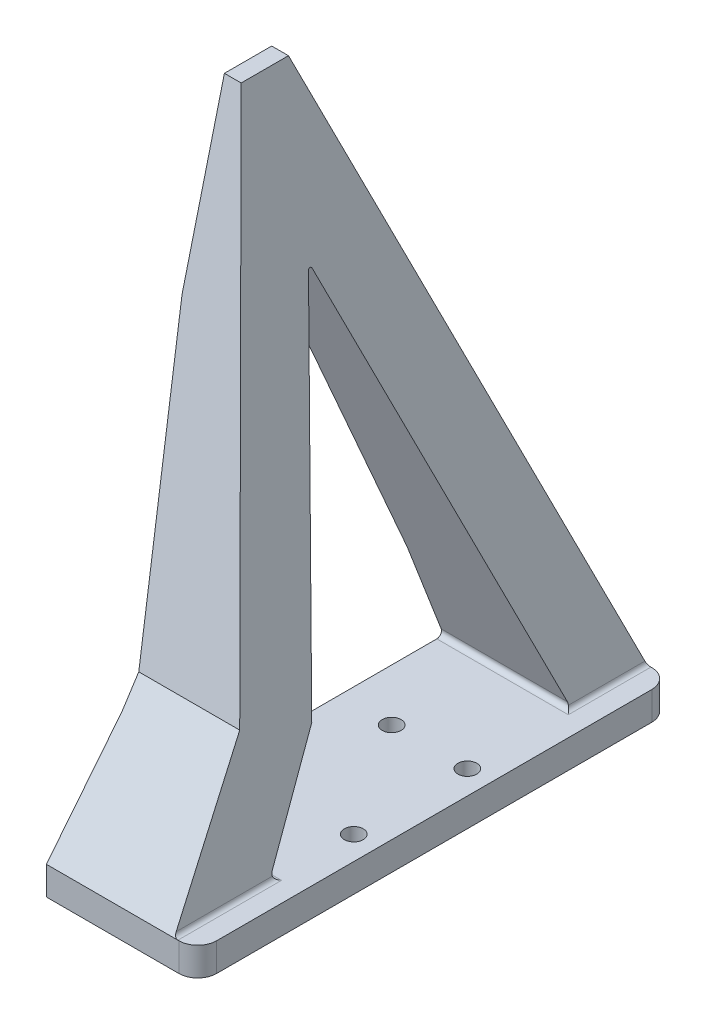
from build123d import *

# Parameters (mm, degrees)
SKETCH_1_R          = 1
EXTRUDE_1_DEPTH     = 3
SKETCH_2_W          = 16.007753667
SKETCH_2_H          = 50
EXTRUDE_2_DEPTH     = 80
CUT_EXTRUDE_1_DEPTH = 89.149011211
CUT_EXTRUDE_2_DEPTH = 81.960252593
EXTRUDE_3_DEPTH     = 3
CUT_EXTRUDE_3_DEPTH = 82.357621032
FILLET_1_R          = 0.5
FILLET_2_R          = 0.2


with BuildPart() as part:
    # 草图1 → 凸台-拉伸1 (new body)
    with BuildSketch(Plane(origin=(0, 0, 0), x_dir=(1, 0, 0), z_dir=(0, 1, 0))):
        with BuildLine():
            Line((-9.25, 25), (7.25, 25))
            ThreePointArc((7.25, 25), (8.664213562, 24.414213562), (9.25, 23))
            Line((9.25, 23), (9.25, -23))
            ThreePointArc((9.25, -23), (8.664213562, -24.414213562), (7.25, -25))
            Line((7.25, -25), (-9.25, -25))
            Line((-9.25, -25), (-9.25, 25))
        make_face()
        with Locations(Location((-1.25, 6, 0), (0, 0, 270))):
            Circle(SKETCH_1_R, mode=Mode.SUBTRACT)
        with Locations(Location((-1.25, -6, 0), (0, 0, 270))):
            Circle(SKETCH_1_R, mode=Mode.SUBTRACT)
        with Locations(Location((6.75, -6, 0), (0, 0, 270))):
            Circle(SKETCH_1_R, mode=Mode.SUBTRACT)
        with Locations(Location((6.75, 6, 0), (0, 0, 270))):
            Circle(SKETCH_1_R, mode=Mode.SUBTRACT)
    extrude(amount=EXTRUDE_1_DEPTH)

    # 草图2 → 凸台-拉伸2 (add)
    with BuildSketch(Plane(origin=(0, 3, 0), x_dir=(1, 0, 0), z_dir=(0, 1, 0))):
        with Locations((-1.246123166, 0)):
            Rectangle(SKETCH_2_W, SKETCH_2_H)
    extrude(amount=EXTRUDE_2_DEPTH)

    # 草图3 → 切除-拉伸1 (cut, through all)
    with BuildSketch(Plane(origin=(6.757753667, 0, 0), x_dir=(0, 0, -1), z_dir=(1, 0, 0))):
        Polygon((-25, 3), (-15, 15.5), (-3.181818182, 63), (1.818181818, 63), (25, 3), (32.784332669, 3), (32.784332669, 88.133626677), (-39.086773644, 88.133626677), (-39.086773644, 3), align=None)
        Polygon((-15, 3), (-8, 13), (0, 47), (17, 3), align=None)
    extrude(amount=-CUT_EXTRUDE_1_DEPTH, mode=Mode.SUBTRACT)

    # 草图4 → 切除-拉伸2 (cut, through all)
    with BuildSketch(Plane.XY.offset(25)):
        Polygon((6.757753667, 3), (6.757753667, 67.763295657), (-9.14963747, 67.763295657), align=None)
    extrude(amount=-CUT_EXTRUDE_2_DEPTH, mode=Mode.SUBTRACT)

    # 草图5 → 凸台-拉伸3 (add)
    with BuildSketch(Plane.ZY.offset(9.25)):
        Polygon((-1.818181818, 63), (-25, 3), (-25, 0), (25, 0), (25, 3), (15, 15.5), (3.181818182, 63), align=None)
        Polygon((0, 47), (-17, 3), (15, 3), (8, 13), align=None, mode=Mode.SUBTRACT)
    extrude(amount=EXTRUDE_3_DEPTH)

    # 草图6 → 切除-拉伸3 (cut, through all)
    with BuildSketch(Plane(origin=(0, 0, -25), x_dir=(-1, 0, 0), z_dir=(0, 0, -1))):
        Polygon((6.75, 0), (6.75, 13), (9.75, 45), (9.75, 64.870972757), (14.09361996, 64.870972757), (14.09361996, 0), align=None)
    extrude(amount=-CUT_EXTRUDE_3_DEPTH, mode=Mode.SUBTRACT)

    # 圆角1
    # the kernel refuses this fillet: 0.5 mm, written as the material it adds along each edge
    with BuildSketch(Plane(origin=(-6.75, 3, 15), x_dir=(0, 0, -1), z_dir=(1, 0, 0))) as fillet_1_piece_1_section:
        with BuildLine():
            CenterArc((FILLET_1_R * 1.92065556157, FILLET_1_R), FILLET_1_R, 145.007979801, 124.992020199)
            Line((FILLET_1_R * 1.10142364105, FILLET_1_R * 1.57346234436), (0, 0))
            Line((0, 0), (FILLET_1_R * 1.92065556157, 0))
        make_face()
    fillet_1_piece_1 = extrude(amount=15.908573119, mode=Mode.PRIVATE)
    fillet_1_piece_1 = split(fillet_1_piece_1, bisect_by=Plane(origin=(6.326718063, 4.754862629, 14.622728055), z_dir=(-0.9711342799096353, -0.23853345757858466, 0)), keep=Keep.TOP, mode=Mode.PRIVATE)
    add(fillet_1_piece_1)
    with BuildSketch(Plane(origin=(8.58076235, 3, -17), x_dir=(0, 0, 1), z_dir=(-1, 0, 0))) as fillet_1_piece_2_section:
        with BuildLine():
            CenterArc((FILLET_1_R * 1.45840694682, FILLET_1_R), FILLET_1_R, 158.875280854, 111.124719146)
            Line((FILLET_1_R * 0.525608812419, FILLET_1_R * 1.3603992792), (0, 0))
            Line((0, 0), (FILLET_1_R * 1.45840694682, 0))
        make_face()
    fillet_1_piece_2 = extrude(amount=15.33076235, mode=Mode.PRIVATE)
    fillet_1_piece_2 = split(fillet_1_piece_2, bisect_by=Plane(origin=(6.334852861, 4.721743663, -16.763347765), z_dir=(-0.9711342799096353, -0.23853345757858466, 0)), keep=Keep.TOP, mode=Mode.PRIVATE)
    add(fillet_1_piece_2)
    with BuildSketch(Plane(origin=(6.757753667, 3, 14.019874802), x_dir=(1, 0, 0), z_dir=(0, 0, 1))) as fillet_1_piece_3_section:
        with BuildLine():
            CenterArc((FILLET_1_R * 0.784100158108, FILLET_1_R), FILLET_1_R, 193.8, 76.2)
            Line((-FILLET_1_R * 0.187034121801, FILLET_1_R * 0.761466542421), (0, 0))
            Line((0, 0), (FILLET_1_R * 0.784100158108, 0))
        make_face()
    fillet_1_piece_3 = extrude(amount=10.980125198, mode=Mode.PRIVATE)
    fillet_1_piece_3 = split(fillet_1_piece_3, bisect_by=Plane(origin=(6.823819727, 0.737200979, 16.583959315), z_dir=(0, 0.5734623443633292, 0.8192319205190398)), keep=Keep.TOP, mode=Mode.PRIVATE)
    fillet_1_piece_3 = split(fillet_1_piece_3, bisect_by=Plane(origin=(6.823819727, 5.521194882, 22.983044095), z_dir=(0, -0.6246950475544246, -0.7808688094430302)), keep=Keep.TOP, mode=Mode.PRIVATE)
    add(fillet_1_piece_3)
    with BuildSketch(Plane(origin=(6.757753667, 3, -25), x_dir=(1, 0, 0), z_dir=(0, 0, 1))) as fillet_1_piece_4_section:
        with BuildLine():
            CenterArc((FILLET_1_R * 0.784100158108, FILLET_1_R), FILLET_1_R, 193.8, 76.2)
            Line((-FILLET_1_R * 0.187034121801, FILLET_1_R * 0.761466542421), (0, 0))
            Line((0, 0), (FILLET_1_R * 0.784100158108, 0))
        make_face()
    fillet_1_piece_4 = extrude(amount=8.980125198, mode=Mode.PRIVATE)
    fillet_1_piece_4 = split(fillet_1_piece_4, bisect_by=Plane(origin=(6.823760744, 4.428941995, -24.447908775), z_dir=(0, -0.36039927920216236, 0.9327981344055969)), keep=Keep.TOP, mode=Mode.PRIVATE)
    fillet_1_piece_4 = split(fillet_1_piece_4, bisect_by=Plane(origin=(6.823760744, 1.739503793, -17.487009898), z_dir=(0, 0.3603992792021622, -0.9327981344055969)), keep=Keep.TOP, mode=Mode.PRIVATE)
    add(fillet_1_piece_4)
    with BuildSketch(Plane(origin=(-6.75, 3, 15), x_dir=(0, 0, -1), z_dir=(1, 0, 0))) as fillet_1_piece_5a_section:
        with BuildLine():
            CenterArc((FILLET_1_R * 1.92065556157, FILLET_1_R), FILLET_1_R, 145.007979801, 124.992020199)
            Line((FILLET_1_R * 1.10142364105, FILLET_1_R * 1.57346234436), (0, 0))
            Line((0, 0), (FILLET_1_R * 1.92065556157, 0))
        make_face()
    fillet_1_piece_5a = extrude(amount=15.908573119, mode=Mode.PRIVATE)
    fillet_1_piece_5a = split(fillet_1_piece_5a, bisect_by=Plane(origin=(6.778509417, 2.915497721, 14.622764636), z_dir=(0.9711342799096353, 0.23853345757858466, 0)), keep=Keep.TOP, mode=Mode.PRIVATE)
    with BuildSketch(Plane(origin=(6.757753667, 3, 14.019874802), x_dir=(1, 0, 0), z_dir=(0, 0, 1))) as fillet_1_piece_5b_section:
        with BuildLine():
            CenterArc((FILLET_1_R * 0.784100158108, FILLET_1_R), FILLET_1_R, 193.8, 76.2)
            Line((-FILLET_1_R * 0.187034121801, FILLET_1_R * 0.761466542421), (0, 0))
            Line((0, 0), (FILLET_1_R * 0.784100158108, 0))
        make_face()
    fillet_1_piece_5b = extrude(amount=10.980125198, mode=Mode.PRIVATE)
    fillet_1_piece_5b = split(fillet_1_piece_5b, bisect_by=Plane(origin=(6.828403151, 3.296038352, 14.792773154), z_dir=(0, -0.5734623443633292, -0.8192319205190398)), keep=Keep.TOP, mode=Mode.PRIVATE)
    fillet_1_piece_5 = fillet_1_piece_5a & fillet_1_piece_5b
    add(fillet_1_piece_5)
    with BuildSketch(Plane(origin=(6.757753667, 3, -25), x_dir=(1, 0, 0), z_dir=(0, 0, 1))) as fillet_1_piece_6a_section:
        with BuildLine():
            CenterArc((FILLET_1_R * 0.784100158108, FILLET_1_R), FILLET_1_R, 193.8, 76.2)
            Line((-FILLET_1_R * 0.187034121801, FILLET_1_R * 0.761466542421), (0, 0))
            Line((0, 0), (FILLET_1_R * 0.784100158108, 0))
        make_face()
    fillet_1_piece_6a = extrude(amount=8.980125198, mode=Mode.PRIVATE)
    fillet_1_piece_6a = split(fillet_1_piece_6a, bisect_by=Plane(origin=(6.826253209, 3.240744299, -16.906985157), z_dir=(0, -0.3603992792021622, 0.9327981344055969)), keep=Keep.TOP, mode=Mode.PRIVATE)
    with BuildSketch(Plane(origin=(8.58076235, 3, -17), x_dir=(0, 0, 1), z_dir=(-1, 0, 0))) as fillet_1_piece_6b_section:
        with BuildLine():
            CenterArc((FILLET_1_R * 1.45840694682, FILLET_1_R), FILLET_1_R, 158.875280854, 111.124719146)
            Line((FILLET_1_R * 0.525608812419, FILLET_1_R * 1.3603992792), (0, 0))
            Line((0, 0), (FILLET_1_R * 1.45840694682, 0))
        make_face()
    fillet_1_piece_6b = extrude(amount=15.33076235, mode=Mode.PRIVATE)
    fillet_1_piece_6b = split(fillet_1_piece_6b, bisect_by=Plane(origin=(6.770254608, 2.949105284, -16.764105763), z_dir=(0.9711342799096353, 0.23853345757858466, 0)), keep=Keep.TOP, mode=Mode.PRIVATE)
    fillet_1_piece_6 = fillet_1_piece_6a & fillet_1_piece_6b
    add(fillet_1_piece_6)

    # 圆角2
    fillet_2_edges = [part.edges().sort_by_distance(p)[0] for p in [
        (-6.899841453, 47, 0),
    ]]
    fillet(fillet_2_edges, radius=FILLET_2_R)


solid = part.part
